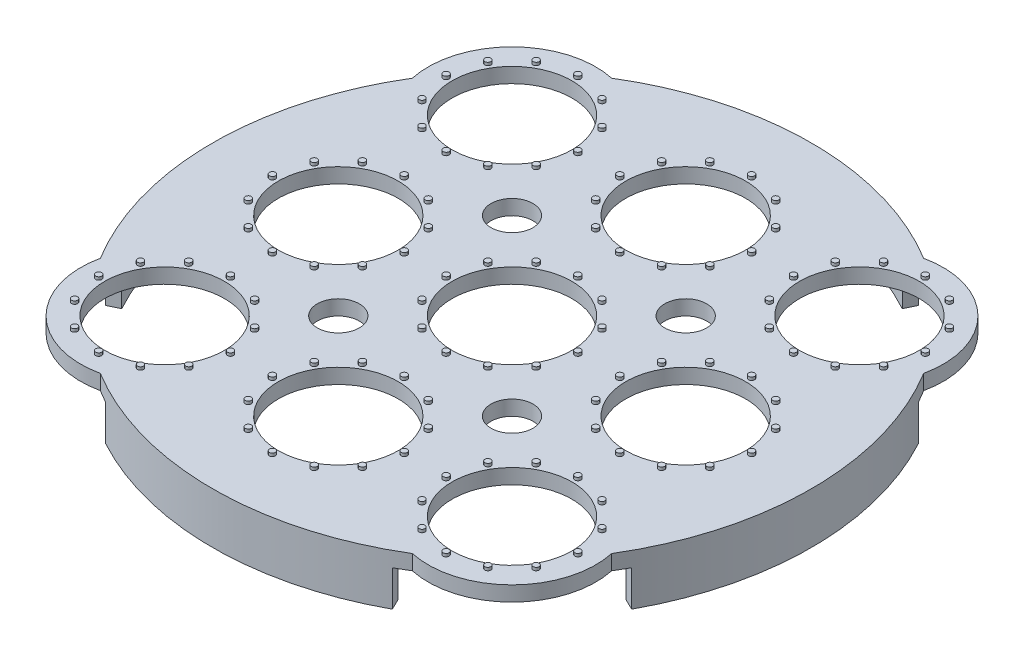
from build123d import *

# Parameters (mm, degrees)
BOSS_EXTRUDE1_DEPTH        = 2.5
SKETCH2_R                  = 10
CUT_EXTRUDE1_DEPTH         = 71.75485849
LPATTERN1_COUNT            = 3
LPATTERN1_PITCH            = 29
LPATTERN1_COUNT_DIR2       = 3
LPATTERN1_PITCH_DIR2       = 29
SKETCH4_R                  = 0.5
BOSS_EXTRUDE2_DEPTH        = 0.5
CIRPATTERN1_COUNT          = 12
LPATTERN2_COUNT            = 3
LPATTERN2_PITCH            = 29
LPATTERN2_COUNT_DIR2       = 3
LPATTERN2_PITCH_DIR2       = 29
LPATTERN2_COPY_1_SKETCH_R  = 0.5
LPATTERN2_COPY_1_DEPTH     = 0.5
LPATTERN2_COPY_2_SKETCH_R  = 0.5
LPATTERN2_COPY_2_DEPTH     = 0.5
LPATTERN2_COPY_3_SKETCH_R  = 0.5
LPATTERN2_COPY_3_DEPTH     = 0.5
LPATTERN2_COPY_4_SKETCH_R  = 0.5
LPATTERN2_COPY_4_DEPTH     = 0.5
LPATTERN2_COPY_5_SKETCH_R  = 0.5
LPATTERN2_COPY_5_DEPTH     = 0.5
LPATTERN2_COPY_6_SKETCH_R  = 0.5
LPATTERN2_COPY_6_DEPTH     = 0.5
LPATTERN2_COPY_7_SKETCH_R  = 0.5
LPATTERN2_COPY_7_DEPTH     = 0.5
LPATTERN2_COPY_8_SKETCH_R  = 0.5
LPATTERN2_COPY_8_DEPTH     = 0.5
LPATTERN2_COPY_9_SKETCH_R  = 0.5
LPATTERN2_COPY_9_DEPTH     = 0.5
LPATTERN2_COPY_10_SKETCH_R = 0.5
LPATTERN2_COPY_10_DEPTH    = 0.5
LPATTERN2_COPY_11_SKETCH_R = 0.5
LPATTERN2_COPY_11_DEPTH    = 0.5
LPATTERN2_COPY_12_SKETCH_R = 0.5
LPATTERN2_COPY_12_DEPTH    = 0.5
LPATTERN2_COPY_13_SKETCH_R = 0.5
LPATTERN2_COPY_13_DEPTH    = 0.5
LPATTERN2_COPY_14_SKETCH_R = 0.5
LPATTERN2_COPY_14_DEPTH    = 0.5
LPATTERN2_COPY_15_SKETCH_R = 0.5
LPATTERN2_COPY_15_DEPTH    = 0.5
LPATTERN2_COPY_16_SKETCH_R = 0.5
LPATTERN2_COPY_16_DEPTH    = 0.5
LPATTERN2_COPY_17_SKETCH_R = 0.5
LPATTERN2_COPY_17_DEPTH    = 0.5
LPATTERN2_COPY_18_SKETCH_R = 0.5
LPATTERN2_COPY_18_DEPTH    = 0.5
LPATTERN2_COPY_19_SKETCH_R = 0.5
LPATTERN2_COPY_19_DEPTH    = 0.5
LPATTERN2_COPY_20_SKETCH_R = 0.5
LPATTERN2_COPY_20_DEPTH    = 0.5
LPATTERN2_COPY_21_SKETCH_R = 0.5
LPATTERN2_COPY_21_DEPTH    = 0.5
LPATTERN2_COPY_22_SKETCH_R = 0.5
LPATTERN2_COPY_22_DEPTH    = 0.5
LPATTERN2_COPY_23_SKETCH_R = 0.5
LPATTERN2_COPY_23_DEPTH    = 0.5
LPATTERN2_COPY_24_SKETCH_R = 0.5
LPATTERN2_COPY_24_DEPTH    = 0.5
LPATTERN2_COPY_25_SKETCH_R = 0.5
LPATTERN2_COPY_25_DEPTH    = 0.5
LPATTERN2_COPY_26_SKETCH_R = 0.5
LPATTERN2_COPY_26_DEPTH    = 0.5
LPATTERN2_COPY_27_SKETCH_R = 0.5
LPATTERN2_COPY_27_DEPTH    = 0.5
LPATTERN2_COPY_28_SKETCH_R = 0.5
LPATTERN2_COPY_28_DEPTH    = 0.5
LPATTERN2_COPY_29_SKETCH_R = 0.5
LPATTERN2_COPY_29_DEPTH    = 0.5
LPATTERN2_COPY_30_SKETCH_R = 0.5
LPATTERN2_COPY_30_DEPTH    = 0.5
LPATTERN2_COPY_31_SKETCH_R = 0.5
LPATTERN2_COPY_31_DEPTH    = 0.5
LPATTERN2_COPY_32_SKETCH_R = 0.5
LPATTERN2_COPY_32_DEPTH    = 0.5
LPATTERN2_COPY_33_SKETCH_R = 0.5
LPATTERN2_COPY_33_DEPTH    = 0.5
LPATTERN2_COPY_34_SKETCH_R = 0.5
LPATTERN2_COPY_34_DEPTH    = 0.5
LPATTERN2_COPY_35_SKETCH_R = 0.5
LPATTERN2_COPY_35_DEPTH    = 0.5
LPATTERN2_COPY_36_SKETCH_R = 0.5
LPATTERN2_COPY_36_DEPTH    = 0.5
LPATTERN2_COPY_37_SKETCH_R = 0.5
LPATTERN2_COPY_37_DEPTH    = 0.5
LPATTERN2_COPY_38_SKETCH_R = 0.5
LPATTERN2_COPY_38_DEPTH    = 0.5
LPATTERN2_COPY_39_SKETCH_R = 0.5
LPATTERN2_COPY_39_DEPTH    = 0.5
LPATTERN2_COPY_40_SKETCH_R = 0.5
LPATTERN2_COPY_40_DEPTH    = 0.5
LPATTERN2_COPY_41_SKETCH_R = 0.5
LPATTERN2_COPY_41_DEPTH    = 0.5
LPATTERN2_COPY_42_SKETCH_R = 0.5
LPATTERN2_COPY_42_DEPTH    = 0.5
LPATTERN2_COPY_43_SKETCH_R = 0.5
LPATTERN2_COPY_43_DEPTH    = 0.5
LPATTERN2_COPY_44_SKETCH_R = 0.5
LPATTERN2_COPY_44_DEPTH    = 0.5
LPATTERN2_COPY_45_SKETCH_R = 0.5
LPATTERN2_COPY_45_DEPTH    = 0.5
LPATTERN2_COPY_46_SKETCH_R = 0.5
LPATTERN2_COPY_46_DEPTH    = 0.5
LPATTERN2_COPY_47_SKETCH_R = 0.5
LPATTERN2_COPY_47_DEPTH    = 0.5
LPATTERN2_COPY_48_SKETCH_R = 0.5
LPATTERN2_COPY_48_DEPTH    = 0.5
LPATTERN2_COPY_49_SKETCH_R = 0.5
LPATTERN2_COPY_49_DEPTH    = 0.5
LPATTERN2_COPY_50_SKETCH_R = 0.5
LPATTERN2_COPY_50_DEPTH    = 0.5
LPATTERN2_COPY_51_SKETCH_R = 0.5
LPATTERN2_COPY_51_DEPTH    = 0.5
LPATTERN2_COPY_52_SKETCH_R = 0.5
LPATTERN2_COPY_52_DEPTH    = 0.5
LPATTERN2_COPY_53_SKETCH_R = 0.5
LPATTERN2_COPY_53_DEPTH    = 0.5
LPATTERN2_COPY_54_SKETCH_R = 0.5
LPATTERN2_COPY_54_DEPTH    = 0.5
LPATTERN2_COPY_55_SKETCH_R = 0.5
LPATTERN2_COPY_55_DEPTH    = 0.5
LPATTERN2_COPY_56_SKETCH_R = 0.5
LPATTERN2_COPY_56_DEPTH    = 0.5
LPATTERN2_COPY_57_SKETCH_R = 0.5
LPATTERN2_COPY_57_DEPTH    = 0.5
LPATTERN2_COPY_58_SKETCH_R = 0.5
LPATTERN2_COPY_58_DEPTH    = 0.5
LPATTERN2_COPY_59_SKETCH_R = 0.5
LPATTERN2_COPY_59_DEPTH    = 0.5
LPATTERN2_COPY_60_SKETCH_R = 0.5
LPATTERN2_COPY_60_DEPTH    = 0.5
LPATTERN2_COPY_61_SKETCH_R = 0.5
LPATTERN2_COPY_61_DEPTH    = 0.5
LPATTERN2_COPY_62_SKETCH_R = 0.5
LPATTERN2_COPY_62_DEPTH    = 0.5
LPATTERN2_COPY_63_SKETCH_R = 0.5
LPATTERN2_COPY_63_DEPTH    = 0.5
LPATTERN2_COPY_64_SKETCH_R = 0.5
LPATTERN2_COPY_64_DEPTH    = 0.5
LPATTERN2_COPY_65_SKETCH_R = 0.5
LPATTERN2_COPY_65_DEPTH    = 0.5
LPATTERN2_COPY_66_SKETCH_R = 0.5
LPATTERN2_COPY_66_DEPTH    = 0.5
LPATTERN2_COPY_67_SKETCH_R = 0.5
LPATTERN2_COPY_67_DEPTH    = 0.5
LPATTERN2_COPY_68_SKETCH_R = 0.5
LPATTERN2_COPY_68_DEPTH    = 0.5
LPATTERN2_COPY_69_SKETCH_R = 0.5
LPATTERN2_COPY_69_DEPTH    = 0.5
LPATTERN2_COPY_70_SKETCH_R = 0.5
LPATTERN2_COPY_70_DEPTH    = 0.5
LPATTERN2_COPY_71_SKETCH_R = 0.5
LPATTERN2_COPY_71_DEPTH    = 0.5
LPATTERN2_COPY_72_SKETCH_R = 0.5
LPATTERN2_COPY_72_DEPTH    = 0.5
LPATTERN2_COPY_73_SKETCH_R = 0.5
LPATTERN2_COPY_73_DEPTH    = 0.5
LPATTERN2_COPY_74_SKETCH_R = 0.5
LPATTERN2_COPY_74_DEPTH    = 0.5
LPATTERN2_COPY_75_SKETCH_R = 0.5
LPATTERN2_COPY_75_DEPTH    = 0.5
LPATTERN2_COPY_76_SKETCH_R = 0.5
LPATTERN2_COPY_76_DEPTH    = 0.5
LPATTERN2_COPY_77_SKETCH_R = 0.5
LPATTERN2_COPY_77_DEPTH    = 0.5
LPATTERN2_COPY_78_SKETCH_R = 0.5
LPATTERN2_COPY_78_DEPTH    = 0.5
LPATTERN2_COPY_79_SKETCH_R = 0.5
LPATTERN2_COPY_79_DEPTH    = 0.5
LPATTERN2_COPY_80_SKETCH_R = 0.5
LPATTERN2_COPY_80_DEPTH    = 0.5
LPATTERN2_COPY_81_SKETCH_R = 0.5
LPATTERN2_COPY_81_DEPTH    = 0.5
LPATTERN2_COPY_82_SKETCH_R = 0.5
LPATTERN2_COPY_82_DEPTH    = 0.5
LPATTERN2_COPY_83_SKETCH_R = 0.5
LPATTERN2_COPY_83_DEPTH    = 0.5
LPATTERN2_COPY_84_SKETCH_R = 0.5
LPATTERN2_COPY_84_DEPTH    = 0.5
LPATTERN2_COPY_85_SKETCH_R = 0.5
LPATTERN2_COPY_85_DEPTH    = 0.5
LPATTERN2_COPY_86_SKETCH_R = 0.5
LPATTERN2_COPY_86_DEPTH    = 0.5
LPATTERN2_COPY_87_SKETCH_R = 0.5
LPATTERN2_COPY_87_DEPTH    = 0.5
LPATTERN2_COPY_88_SKETCH_R = 0.5
LPATTERN2_COPY_88_DEPTH    = 0.5
SKETCH5_R                  = 3.5
CUT_EXTRUDE2_DEPTH         = 71.75485849
MIRROR2_COPY_1_SKETCH_R    = 3.5
MIRROR2_COPY_1_DEPTH       = 71.75485849
BOSS_EXTRUDE3_START        = 6
BOSS_EXTRUDE3_DEPTH        = 6
CIRPATTERN2_COUNT          = 4


with BuildPart() as part:
    # Sketch1 → Boss-Extrude1 (new body)
    with BuildSketch(Plane(origin=(0, 0, 0), x_dir=(1, 0, 0), z_dir=(0, 1, 0))):
        with BuildLine():
            ThreePointArc((26.040517643, 42.683620288), (0, 50), (-26.040517643, 42.683620288))
            ThreePointArc((-26.040517643, 42.683620288), (-38.899494937, 38.899494937), (-42.683620288, 26.040517643))
            ThreePointArc((-42.683620288, 26.040517643), (-50, 0), (-42.683620288, -26.040517643))
            ThreePointArc((-42.683620288, -26.040517643), (-38.899494937, -38.899494937), (-26.040517643, -42.683620288))
            ThreePointArc((-26.040517643, -42.683620288), (0, -50), (26.040517643, -42.683620288))
            ThreePointArc((26.040517643, -42.683620288), (38.899494937, -38.899494937), (42.683620288, -26.040517643))
            ThreePointArc((42.683620288, -26.040517643), (50, 0), (42.683620288, 26.040517643))
            ThreePointArc((42.683620288, 26.040517643), (38.899494937, 38.899494937), (26.040517643, 42.683620288))
        make_face()
    extrude(amount=BOSS_EXTRUDE1_DEPTH)

    # Sketch2 → Cut-Extrude1 (cut, through all)
    with BuildSketch(Plane(origin=(0, 2.5, 0), x_dir=(1, 0, 0), z_dir=(0, 1, 0))):
        with Locations((-29, -29)):
            Circle(SKETCH2_R)
    cut_extrude1 = extrude(amount=-CUT_EXTRUDE1_DEPTH, mode=Mode.SUBTRACT)

    # LPattern1: Cut-Extrude1 3 × 3
    with Locations(*[(i * LPATTERN1_PITCH, 0, -j * LPATTERN1_PITCH_DIR2) for i in range(LPATTERN1_COUNT) for j in range(LPATTERN1_COUNT_DIR2) if (i, j) != (0, 0)]):
        add(cut_extrude1, mode=Mode.SUBTRACT)

    # Sketch4 → Boss-Extrude2 (add)
    with BuildSketch(Plane(origin=(0, 2.5, 0), x_dir=(1, 0, 0), z_dir=(0, 1, 0))):
        with Locations((-29, -18)):
            Circle(SKETCH4_R)
    boss_extrude2 = extrude(amount=BOSS_EXTRUDE2_DEPTH)

    # CirPattern1: Boss-Extrude2 ×12 about axis
    cirpattern1_axis = Axis((-29, 0, 29), (0, 1, 0))
    for i in range(1, CIRPATTERN1_COUNT):
        add(boss_extrude2.rotate(cirpattern1_axis, i * 360 / CIRPATTERN1_COUNT))

    # LPattern2: Boss-Extrude2 3 × 3
    with Locations(*[(j * LPATTERN2_PITCH_DIR2, 0, -i * LPATTERN2_PITCH) for i in range(LPATTERN2_COUNT) for j in range(LPATTERN2_COUNT_DIR2) if (i, j) != (0, 0)]):
        add(boss_extrude2)

    # LPattern2 copy 1 sketch → LPattern2 copy 1 (add)
    with BuildSketch(Plane(origin=(10.61473671, 2.5, -10.61473671), x_dir=(0.8660254037844387, 0, -0.49999999999999994), z_dir=(0, 1, 0))):
        with Locations((-29, -18)):
            Circle(LPATTERN2_COPY_1_SKETCH_R)
    extrude(amount=LPATTERN2_COPY_1_DEPTH)

    # LPattern2 copy 2 sketch → LPattern2 copy 2 (add)
    with BuildSketch(Plane(origin=(39.61473671, 2.5, -10.61473671), x_dir=(0.8660254037844387, 0, -0.49999999999999994), z_dir=(0, 1, 0))):
        with Locations((-29, -18)):
            Circle(LPATTERN2_COPY_2_SKETCH_R)
    extrude(amount=LPATTERN2_COPY_2_DEPTH)

    # LPattern2 copy 3 sketch → LPattern2 copy 3 (add)
    with BuildSketch(Plane(origin=(-18.38526329, 2.5, -39.61473671), x_dir=(0.8660254037844387, 0, -0.49999999999999994), z_dir=(0, 1, 0))):
        with Locations((-29, -18)):
            Circle(LPATTERN2_COPY_3_SKETCH_R)
    extrude(amount=LPATTERN2_COPY_3_DEPTH)

    # LPattern2 copy 4 sketch → LPattern2 copy 4 (add)
    with BuildSketch(Plane(origin=(10.61473671, 2.5, -39.61473671), x_dir=(0.8660254037844387, 0, -0.49999999999999994), z_dir=(0, 1, 0))):
        with Locations((-29, -18)):
            Circle(LPATTERN2_COPY_4_SKETCH_R)
    extrude(amount=LPATTERN2_COPY_4_DEPTH)

    # LPattern2 copy 5 sketch → LPattern2 copy 5 (add)
    with BuildSketch(Plane(origin=(39.61473671, 2.5, -39.61473671), x_dir=(0.8660254037844387, 0, -0.49999999999999994), z_dir=(0, 1, 0))):
        with Locations((-29, -18)):
            Circle(LPATTERN2_COPY_5_SKETCH_R)
    extrude(amount=LPATTERN2_COPY_5_DEPTH)

    # LPattern2 copy 6 sketch → LPattern2 copy 6 (add)
    with BuildSketch(Plane(origin=(-18.38526329, 2.5, -68.61473671), x_dir=(0.8660254037844387, 0, -0.49999999999999994), z_dir=(0, 1, 0))):
        with Locations((-29, -18)):
            Circle(LPATTERN2_COPY_6_SKETCH_R)
    extrude(amount=LPATTERN2_COPY_6_DEPTH)

    # LPattern2 copy 7 sketch → LPattern2 copy 7 (add)
    with BuildSketch(Plane(origin=(10.61473671, 2.5, -68.61473671), x_dir=(0.8660254037844387, 0, -0.49999999999999994), z_dir=(0, 1, 0))):
        with Locations((-29, -18)):
            Circle(LPATTERN2_COPY_7_SKETCH_R)
    extrude(amount=LPATTERN2_COPY_7_DEPTH)

    # LPattern2 copy 8 sketch → LPattern2 copy 8 (add)
    with BuildSketch(Plane(origin=(39.61473671, 2.5, -68.61473671), x_dir=(0.8660254037844387, 0, -0.49999999999999994), z_dir=(0, 1, 0))):
        with Locations((-29, -18)):
            Circle(LPATTERN2_COPY_8_SKETCH_R)
    extrude(amount=LPATTERN2_COPY_8_DEPTH)

    # LPattern2 copy 9 sketch → LPattern2 copy 9 (add)
    with BuildSketch(Plane(origin=(-10.61473671, 2.5, -10.61473671), x_dir=(0.5000000000000001, 0, -0.8660254037844386), z_dir=(0, 1, 0))):
        with Locations((-29, -18)):
            Circle(LPATTERN2_COPY_9_SKETCH_R)
    extrude(amount=LPATTERN2_COPY_9_DEPTH)

    # LPattern2 copy 10 sketch → LPattern2 copy 10 (add)
    with BuildSketch(Plane(origin=(18.38526329, 2.5, -10.61473671), x_dir=(0.5000000000000001, 0, -0.8660254037844386), z_dir=(0, 1, 0))):
        with Locations((-29, -18)):
            Circle(LPATTERN2_COPY_10_SKETCH_R)
    extrude(amount=LPATTERN2_COPY_10_DEPTH)

    # LPattern2 copy 11 sketch → LPattern2 copy 11 (add)
    with BuildSketch(Plane(origin=(-39.61473671, 2.5, -39.61473671), x_dir=(0.5000000000000001, 0, -0.8660254037844386), z_dir=(0, 1, 0))):
        with Locations((-29, -18)):
            Circle(LPATTERN2_COPY_11_SKETCH_R)
    extrude(amount=LPATTERN2_COPY_11_DEPTH)

    # LPattern2 copy 12 sketch → LPattern2 copy 12 (add)
    with BuildSketch(Plane(origin=(-10.61473671, 2.5, -39.61473671), x_dir=(0.5000000000000001, 0, -0.8660254037844386), z_dir=(0, 1, 0))):
        with Locations((-29, -18)):
            Circle(LPATTERN2_COPY_12_SKETCH_R)
    extrude(amount=LPATTERN2_COPY_12_DEPTH)

    # LPattern2 copy 13 sketch → LPattern2 copy 13 (add)
    with BuildSketch(Plane(origin=(18.38526329, 2.5, -39.61473671), x_dir=(0.5000000000000001, 0, -0.8660254037844386), z_dir=(0, 1, 0))):
        with Locations((-29, -18)):
            Circle(LPATTERN2_COPY_13_SKETCH_R)
    extrude(amount=LPATTERN2_COPY_13_DEPTH)

    # LPattern2 copy 14 sketch → LPattern2 copy 14 (add)
    with BuildSketch(Plane(origin=(-39.61473671, 2.5, -68.61473671), x_dir=(0.5000000000000001, 0, -0.8660254037844386), z_dir=(0, 1, 0))):
        with Locations((-29, -18)):
            Circle(LPATTERN2_COPY_14_SKETCH_R)
    extrude(amount=LPATTERN2_COPY_14_DEPTH)

    # LPattern2 copy 15 sketch → LPattern2 copy 15 (add)
    with BuildSketch(Plane(origin=(-10.61473671, 2.5, -68.61473671), x_dir=(0.5000000000000001, 0, -0.8660254037844386), z_dir=(0, 1, 0))):
        with Locations((-29, -18)):
            Circle(LPATTERN2_COPY_15_SKETCH_R)
    extrude(amount=LPATTERN2_COPY_15_DEPTH)

    # LPattern2 copy 16 sketch → LPattern2 copy 16 (add)
    with BuildSketch(Plane(origin=(18.38526329, 2.5, -68.61473671), x_dir=(0.5000000000000001, 0, -0.8660254037844386), z_dir=(0, 1, 0))):
        with Locations((-29, -18)):
            Circle(LPATTERN2_COPY_16_SKETCH_R)
    extrude(amount=LPATTERN2_COPY_16_DEPTH)

    # LPattern2 copy 17 sketch → LPattern2 copy 17 (add)
    with BuildSketch(Plane(origin=(-29, 2.5, 0), x_dir=(0, 0, -1), z_dir=(0, 1, 0))):
        with Locations((-29, -18)):
            Circle(LPATTERN2_COPY_17_SKETCH_R)
    extrude(amount=LPATTERN2_COPY_17_DEPTH)

    # LPattern2 copy 18 sketch → LPattern2 copy 18 (add)
    with BuildSketch(Plane(origin=(0, 2.5, 0), x_dir=(0, 0, -1), z_dir=(0, 1, 0))):
        with Locations((-29, -18)):
            Circle(LPATTERN2_COPY_18_SKETCH_R)
    extrude(amount=LPATTERN2_COPY_18_DEPTH)

    # LPattern2 copy 19 sketch → LPattern2 copy 19 (add)
    with BuildSketch(Plane(origin=(-58, 2.5, -29), x_dir=(0, 0, -1), z_dir=(0, 1, 0))):
        with Locations((-29, -18)):
            Circle(LPATTERN2_COPY_19_SKETCH_R)
    extrude(amount=LPATTERN2_COPY_19_DEPTH)

    # LPattern2 copy 20 sketch → LPattern2 copy 20 (add)
    with BuildSketch(Plane(origin=(-29, 2.5, -29), x_dir=(0, 0, -1), z_dir=(0, 1, 0))):
        with Locations((-29, -18)):
            Circle(LPATTERN2_COPY_20_SKETCH_R)
    extrude(amount=LPATTERN2_COPY_20_DEPTH)

    # LPattern2 copy 21 sketch → LPattern2 copy 21 (add)
    with BuildSketch(Plane(origin=(0, 2.5, -29), x_dir=(0, 0, -1), z_dir=(0, 1, 0))):
        with Locations((-29, -18)):
            Circle(LPATTERN2_COPY_21_SKETCH_R)
    extrude(amount=LPATTERN2_COPY_21_DEPTH)

    # LPattern2 copy 22 sketch → LPattern2 copy 22 (add)
    with BuildSketch(Plane(origin=(-58, 2.5, -58), x_dir=(0, 0, -1), z_dir=(0, 1, 0))):
        with Locations((-29, -18)):
            Circle(LPATTERN2_COPY_22_SKETCH_R)
    extrude(amount=LPATTERN2_COPY_22_DEPTH)

    # LPattern2 copy 23 sketch → LPattern2 copy 23 (add)
    with BuildSketch(Plane(origin=(-29, 2.5, -58), x_dir=(0, 0, -1), z_dir=(0, 1, 0))):
        with Locations((-29, -18)):
            Circle(LPATTERN2_COPY_23_SKETCH_R)
    extrude(amount=LPATTERN2_COPY_23_DEPTH)

    # LPattern2 copy 24 sketch → LPattern2 copy 24 (add)
    with BuildSketch(Plane(origin=(0, 2.5, -58), x_dir=(0, 0, -1), z_dir=(0, 1, 0))):
        with Locations((-29, -18)):
            Circle(LPATTERN2_COPY_24_SKETCH_R)
    extrude(amount=LPATTERN2_COPY_24_DEPTH)

    # LPattern2 copy 25 sketch → LPattern2 copy 25 (add)
    with BuildSketch(Plane(origin=(-39.61473671, 2.5, 18.38526329), x_dir=(-0.4999999999999998, 0, -0.8660254037844387), z_dir=(0, 1, 0))):
        with Locations((-29, -18)):
            Circle(LPATTERN2_COPY_25_SKETCH_R)
    extrude(amount=LPATTERN2_COPY_25_DEPTH)

    # LPattern2 copy 26 sketch → LPattern2 copy 26 (add)
    with BuildSketch(Plane(origin=(-10.61473671, 2.5, 18.38526329), x_dir=(-0.4999999999999998, 0, -0.8660254037844387), z_dir=(0, 1, 0))):
        with Locations((-29, -18)):
            Circle(LPATTERN2_COPY_26_SKETCH_R)
    extrude(amount=LPATTERN2_COPY_26_DEPTH)

    # LPattern2 copy 27 sketch → LPattern2 copy 27 (add)
    with BuildSketch(Plane(origin=(-68.61473671, 2.5, -10.61473671), x_dir=(-0.4999999999999998, 0, -0.8660254037844387), z_dir=(0, 1, 0))):
        with Locations((-29, -18)):
            Circle(LPATTERN2_COPY_27_SKETCH_R)
    extrude(amount=LPATTERN2_COPY_27_DEPTH)

    # LPattern2 copy 28 sketch → LPattern2 copy 28 (add)
    with BuildSketch(Plane(origin=(-39.61473671, 2.5, -10.61473671), x_dir=(-0.4999999999999998, 0, -0.8660254037844387), z_dir=(0, 1, 0))):
        with Locations((-29, -18)):
            Circle(LPATTERN2_COPY_28_SKETCH_R)
    extrude(amount=LPATTERN2_COPY_28_DEPTH)

    # LPattern2 copy 29 sketch → LPattern2 copy 29 (add)
    with BuildSketch(Plane(origin=(-10.61473671, 2.5, -10.61473671), x_dir=(-0.4999999999999998, 0, -0.8660254037844387), z_dir=(0, 1, 0))):
        with Locations((-29, -18)):
            Circle(LPATTERN2_COPY_29_SKETCH_R)
    extrude(amount=LPATTERN2_COPY_29_DEPTH)

    # LPattern2 copy 30 sketch → LPattern2 copy 30 (add)
    with BuildSketch(Plane(origin=(-68.61473671, 2.5, -39.61473671), x_dir=(-0.4999999999999998, 0, -0.8660254037844387), z_dir=(0, 1, 0))):
        with Locations((-29, -18)):
            Circle(LPATTERN2_COPY_30_SKETCH_R)
    extrude(amount=LPATTERN2_COPY_30_DEPTH)

    # LPattern2 copy 31 sketch → LPattern2 copy 31 (add)
    with BuildSketch(Plane(origin=(-39.61473671, 2.5, -39.61473671), x_dir=(-0.4999999999999998, 0, -0.8660254037844387), z_dir=(0, 1, 0))):
        with Locations((-29, -18)):
            Circle(LPATTERN2_COPY_31_SKETCH_R)
    extrude(amount=LPATTERN2_COPY_31_DEPTH)

    # LPattern2 copy 32 sketch → LPattern2 copy 32 (add)
    with BuildSketch(Plane(origin=(-10.61473671, 2.5, -39.61473671), x_dir=(-0.4999999999999998, 0, -0.8660254037844387), z_dir=(0, 1, 0))):
        with Locations((-29, -18)):
            Circle(LPATTERN2_COPY_32_SKETCH_R)
    extrude(amount=LPATTERN2_COPY_32_DEPTH)

    # LPattern2 copy 33 sketch → LPattern2 copy 33 (add)
    with BuildSketch(Plane(origin=(-39.61473671, 2.5, 39.61473671), x_dir=(-0.8660254037844387, 0, -0.49999999999999994), z_dir=(0, 1, 0))):
        with Locations((-29, -18)):
            Circle(LPATTERN2_COPY_33_SKETCH_R)
    extrude(amount=LPATTERN2_COPY_33_DEPTH)

    # LPattern2 copy 34 sketch → LPattern2 copy 34 (add)
    with BuildSketch(Plane(origin=(-10.61473671, 2.5, 39.61473671), x_dir=(-0.8660254037844387, 0, -0.49999999999999994), z_dir=(0, 1, 0))):
        with Locations((-29, -18)):
            Circle(LPATTERN2_COPY_34_SKETCH_R)
    extrude(amount=LPATTERN2_COPY_34_DEPTH)

    # LPattern2 copy 35 sketch → LPattern2 copy 35 (add)
    with BuildSketch(Plane(origin=(-68.61473671, 2.5, 10.61473671), x_dir=(-0.8660254037844387, 0, -0.49999999999999994), z_dir=(0, 1, 0))):
        with Locations((-29, -18)):
            Circle(LPATTERN2_COPY_35_SKETCH_R)
    extrude(amount=LPATTERN2_COPY_35_DEPTH)

    # LPattern2 copy 36 sketch → LPattern2 copy 36 (add)
    with BuildSketch(Plane(origin=(-39.61473671, 2.5, 10.61473671), x_dir=(-0.8660254037844387, 0, -0.49999999999999994), z_dir=(0, 1, 0))):
        with Locations((-29, -18)):
            Circle(LPATTERN2_COPY_36_SKETCH_R)
    extrude(amount=LPATTERN2_COPY_36_DEPTH)

    # LPattern2 copy 37 sketch → LPattern2 copy 37 (add)
    with BuildSketch(Plane(origin=(-10.61473671, 2.5, 10.61473671), x_dir=(-0.8660254037844387, 0, -0.49999999999999994), z_dir=(0, 1, 0))):
        with Locations((-29, -18)):
            Circle(LPATTERN2_COPY_37_SKETCH_R)
    extrude(amount=LPATTERN2_COPY_37_DEPTH)

    # LPattern2 copy 38 sketch → LPattern2 copy 38 (add)
    with BuildSketch(Plane(origin=(-68.61473671, 2.5, -18.38526329), x_dir=(-0.8660254037844387, 0, -0.49999999999999994), z_dir=(0, 1, 0))):
        with Locations((-29, -18)):
            Circle(LPATTERN2_COPY_38_SKETCH_R)
    extrude(amount=LPATTERN2_COPY_38_DEPTH)

    # LPattern2 copy 39 sketch → LPattern2 copy 39 (add)
    with BuildSketch(Plane(origin=(-39.61473671, 2.5, -18.38526329), x_dir=(-0.8660254037844387, 0, -0.49999999999999994), z_dir=(0, 1, 0))):
        with Locations((-29, -18)):
            Circle(LPATTERN2_COPY_39_SKETCH_R)
    extrude(amount=LPATTERN2_COPY_39_DEPTH)

    # LPattern2 copy 40 sketch → LPattern2 copy 40 (add)
    with BuildSketch(Plane(origin=(-10.61473671, 2.5, -18.38526329), x_dir=(-0.8660254037844387, 0, -0.49999999999999994), z_dir=(0, 1, 0))):
        with Locations((-29, -18)):
            Circle(LPATTERN2_COPY_40_SKETCH_R)
    extrude(amount=LPATTERN2_COPY_40_DEPTH)

    # LPattern2 copy 41 sketch → LPattern2 copy 41 (add)
    with BuildSketch(Plane(origin=(-29, 2.5, 58), x_dir=(-1, 0, 0), z_dir=(0, 1, 0))):
        with Locations((-29, -18)):
            Circle(LPATTERN2_COPY_41_SKETCH_R)
    extrude(amount=LPATTERN2_COPY_41_DEPTH)

    # LPattern2 copy 42 sketch → LPattern2 copy 42 (add)
    with BuildSketch(Plane(origin=(0, 2.5, 58), x_dir=(-1, 0, 0), z_dir=(0, 1, 0))):
        with Locations((-29, -18)):
            Circle(LPATTERN2_COPY_42_SKETCH_R)
    extrude(amount=LPATTERN2_COPY_42_DEPTH)

    # LPattern2 copy 43 sketch → LPattern2 copy 43 (add)
    with BuildSketch(Plane(origin=(-58, 2.5, 29), x_dir=(-1, 0, 0), z_dir=(0, 1, 0))):
        with Locations((-29, -18)):
            Circle(LPATTERN2_COPY_43_SKETCH_R)
    extrude(amount=LPATTERN2_COPY_43_DEPTH)

    # LPattern2 copy 44 sketch → LPattern2 copy 44 (add)
    with BuildSketch(Plane(origin=(-29, 2.5, 29), x_dir=(-1, 0, 0), z_dir=(0, 1, 0))):
        with Locations((-29, -18)):
            Circle(LPATTERN2_COPY_44_SKETCH_R)
    extrude(amount=LPATTERN2_COPY_44_DEPTH)

    # LPattern2 copy 45 sketch → LPattern2 copy 45 (add)
    with BuildSketch(Plane(origin=(0, 2.5, 29), x_dir=(-1, 0, 0), z_dir=(0, 1, 0))):
        with Locations((-29, -18)):
            Circle(LPATTERN2_COPY_45_SKETCH_R)
    extrude(amount=LPATTERN2_COPY_45_DEPTH)

    # LPattern2 copy 46 sketch → LPattern2 copy 46 (add)
    with BuildSketch(Plane(origin=(-58, 2.5, 0), x_dir=(-1, 0, 0), z_dir=(0, 1, 0))):
        with Locations((-29, -18)):
            Circle(LPATTERN2_COPY_46_SKETCH_R)
    extrude(amount=LPATTERN2_COPY_46_DEPTH)

    # LPattern2 copy 47 sketch → LPattern2 copy 47 (add)
    with BuildSketch(Plane(origin=(-29, 2.5, 0), x_dir=(-1, 0, 0), z_dir=(0, 1, 0))):
        with Locations((-29, -18)):
            Circle(LPATTERN2_COPY_47_SKETCH_R)
    extrude(amount=LPATTERN2_COPY_47_DEPTH)

    # LPattern2 copy 48 sketch → LPattern2 copy 48 (add)
    with BuildSketch(Plane(origin=(0, 2.5, 0), x_dir=(-1, 0, 0), z_dir=(0, 1, 0))):
        with Locations((-29, -18)):
            Circle(LPATTERN2_COPY_48_SKETCH_R)
    extrude(amount=LPATTERN2_COPY_48_DEPTH)

    # LPattern2 copy 49 sketch → LPattern2 copy 49 (add)
    with BuildSketch(Plane(origin=(-10.61473671, 2.5, 68.61473671), x_dir=(-0.8660254037844386, 0, 0.5000000000000001), z_dir=(0, 1, 0))):
        with Locations((-29, -18)):
            Circle(LPATTERN2_COPY_49_SKETCH_R)
    extrude(amount=LPATTERN2_COPY_49_DEPTH)

    # LPattern2 copy 50 sketch → LPattern2 copy 50 (add)
    with BuildSketch(Plane(origin=(18.38526329, 2.5, 68.61473671), x_dir=(-0.8660254037844386, 0, 0.5000000000000001), z_dir=(0, 1, 0))):
        with Locations((-29, -18)):
            Circle(LPATTERN2_COPY_50_SKETCH_R)
    extrude(amount=LPATTERN2_COPY_50_DEPTH)

    # LPattern2 copy 51 sketch → LPattern2 copy 51 (add)
    with BuildSketch(Plane(origin=(-39.61473671, 2.5, 39.61473671), x_dir=(-0.8660254037844386, 0, 0.5000000000000001), z_dir=(0, 1, 0))):
        with Locations((-29, -18)):
            Circle(LPATTERN2_COPY_51_SKETCH_R)
    extrude(amount=LPATTERN2_COPY_51_DEPTH)

    # LPattern2 copy 52 sketch → LPattern2 copy 52 (add)
    with BuildSketch(Plane(origin=(-10.61473671, 2.5, 39.61473671), x_dir=(-0.8660254037844386, 0, 0.5000000000000001), z_dir=(0, 1, 0))):
        with Locations((-29, -18)):
            Circle(LPATTERN2_COPY_52_SKETCH_R)
    extrude(amount=LPATTERN2_COPY_52_DEPTH)

    # LPattern2 copy 53 sketch → LPattern2 copy 53 (add)
    with BuildSketch(Plane(origin=(18.38526329, 2.5, 39.61473671), x_dir=(-0.8660254037844386, 0, 0.5000000000000001), z_dir=(0, 1, 0))):
        with Locations((-29, -18)):
            Circle(LPATTERN2_COPY_53_SKETCH_R)
    extrude(amount=LPATTERN2_COPY_53_DEPTH)

    # LPattern2 copy 54 sketch → LPattern2 copy 54 (add)
    with BuildSketch(Plane(origin=(-39.61473671, 2.5, 10.61473671), x_dir=(-0.8660254037844386, 0, 0.5000000000000001), z_dir=(0, 1, 0))):
        with Locations((-29, -18)):
            Circle(LPATTERN2_COPY_54_SKETCH_R)
    extrude(amount=LPATTERN2_COPY_54_DEPTH)

    # LPattern2 copy 55 sketch → LPattern2 copy 55 (add)
    with BuildSketch(Plane(origin=(-10.61473671, 2.5, 10.61473671), x_dir=(-0.8660254037844386, 0, 0.5000000000000001), z_dir=(0, 1, 0))):
        with Locations((-29, -18)):
            Circle(LPATTERN2_COPY_55_SKETCH_R)
    extrude(amount=LPATTERN2_COPY_55_DEPTH)

    # LPattern2 copy 56 sketch → LPattern2 copy 56 (add)
    with BuildSketch(Plane(origin=(18.38526329, 2.5, 10.61473671), x_dir=(-0.8660254037844386, 0, 0.5000000000000001), z_dir=(0, 1, 0))):
        with Locations((-29, -18)):
            Circle(LPATTERN2_COPY_56_SKETCH_R)
    extrude(amount=LPATTERN2_COPY_56_DEPTH)

    # LPattern2 copy 57 sketch → LPattern2 copy 57 (add)
    with BuildSketch(Plane(origin=(10.61473671, 2.5, 68.61473671), x_dir=(-0.5000000000000004, 0, 0.8660254037844384), z_dir=(0, 1, 0))):
        with Locations((-29, -18)):
            Circle(LPATTERN2_COPY_57_SKETCH_R)
    extrude(amount=LPATTERN2_COPY_57_DEPTH)

    # LPattern2 copy 58 sketch → LPattern2 copy 58 (add)
    with BuildSketch(Plane(origin=(39.61473671, 2.5, 68.61473671), x_dir=(-0.5000000000000004, 0, 0.8660254037844384), z_dir=(0, 1, 0))):
        with Locations((-29, -18)):
            Circle(LPATTERN2_COPY_58_SKETCH_R)
    extrude(amount=LPATTERN2_COPY_58_DEPTH)

    # LPattern2 copy 59 sketch → LPattern2 copy 59 (add)
    with BuildSketch(Plane(origin=(-18.38526329, 2.5, 39.61473671), x_dir=(-0.5000000000000004, 0, 0.8660254037844384), z_dir=(0, 1, 0))):
        with Locations((-29, -18)):
            Circle(LPATTERN2_COPY_59_SKETCH_R)
    extrude(amount=LPATTERN2_COPY_59_DEPTH)

    # LPattern2 copy 60 sketch → LPattern2 copy 60 (add)
    with BuildSketch(Plane(origin=(10.61473671, 2.5, 39.61473671), x_dir=(-0.5000000000000004, 0, 0.8660254037844384), z_dir=(0, 1, 0))):
        with Locations((-29, -18)):
            Circle(LPATTERN2_COPY_60_SKETCH_R)
    extrude(amount=LPATTERN2_COPY_60_DEPTH)

    # LPattern2 copy 61 sketch → LPattern2 copy 61 (add)
    with BuildSketch(Plane(origin=(39.61473671, 2.5, 39.61473671), x_dir=(-0.5000000000000004, 0, 0.8660254037844384), z_dir=(0, 1, 0))):
        with Locations((-29, -18)):
            Circle(LPATTERN2_COPY_61_SKETCH_R)
    extrude(amount=LPATTERN2_COPY_61_DEPTH)

    # LPattern2 copy 62 sketch → LPattern2 copy 62 (add)
    with BuildSketch(Plane(origin=(-18.38526329, 2.5, 10.61473671), x_dir=(-0.5000000000000004, 0, 0.8660254037844384), z_dir=(0, 1, 0))):
        with Locations((-29, -18)):
            Circle(LPATTERN2_COPY_62_SKETCH_R)
    extrude(amount=LPATTERN2_COPY_62_DEPTH)

    # LPattern2 copy 63 sketch → LPattern2 copy 63 (add)
    with BuildSketch(Plane(origin=(10.61473671, 2.5, 10.61473671), x_dir=(-0.5000000000000004, 0, 0.8660254037844384), z_dir=(0, 1, 0))):
        with Locations((-29, -18)):
            Circle(LPATTERN2_COPY_63_SKETCH_R)
    extrude(amount=LPATTERN2_COPY_63_DEPTH)

    # LPattern2 copy 64 sketch → LPattern2 copy 64 (add)
    with BuildSketch(Plane(origin=(39.61473671, 2.5, 10.61473671), x_dir=(-0.5000000000000004, 0, 0.8660254037844384), z_dir=(0, 1, 0))):
        with Locations((-29, -18)):
            Circle(LPATTERN2_COPY_64_SKETCH_R)
    extrude(amount=LPATTERN2_COPY_64_DEPTH)

    # LPattern2 copy 65 sketch → LPattern2 copy 65 (add)
    with BuildSketch(Plane(origin=(29, 2.5, 58), x_dir=(0, 0, 1), z_dir=(0, 1, 0))):
        with Locations((-29, -18)):
            Circle(LPATTERN2_COPY_65_SKETCH_R)
    extrude(amount=LPATTERN2_COPY_65_DEPTH)

    # LPattern2 copy 66 sketch → LPattern2 copy 66 (add)
    with BuildSketch(Plane(origin=(58, 2.5, 58), x_dir=(0, 0, 1), z_dir=(0, 1, 0))):
        with Locations((-29, -18)):
            Circle(LPATTERN2_COPY_66_SKETCH_R)
    extrude(amount=LPATTERN2_COPY_66_DEPTH)

    # LPattern2 copy 67 sketch → LPattern2 copy 67 (add)
    with BuildSketch(Plane(origin=(0, 2.5, 29), x_dir=(0, 0, 1), z_dir=(0, 1, 0))):
        with Locations((-29, -18)):
            Circle(LPATTERN2_COPY_67_SKETCH_R)
    extrude(amount=LPATTERN2_COPY_67_DEPTH)

    # LPattern2 copy 68 sketch → LPattern2 copy 68 (add)
    with BuildSketch(Plane(origin=(29, 2.5, 29), x_dir=(0, 0, 1), z_dir=(0, 1, 0))):
        with Locations((-29, -18)):
            Circle(LPATTERN2_COPY_68_SKETCH_R)
    extrude(amount=LPATTERN2_COPY_68_DEPTH)

    # LPattern2 copy 69 sketch → LPattern2 copy 69 (add)
    with BuildSketch(Plane(origin=(58, 2.5, 29), x_dir=(0, 0, 1), z_dir=(0, 1, 0))):
        with Locations((-29, -18)):
            Circle(LPATTERN2_COPY_69_SKETCH_R)
    extrude(amount=LPATTERN2_COPY_69_DEPTH)

    # LPattern2 copy 70 sketch → LPattern2 copy 70 (add)
    with BuildSketch(Plane.ZX.offset(2.5)):
        with Locations((-29, -18)):
            Circle(LPATTERN2_COPY_70_SKETCH_R)
    extrude(amount=LPATTERN2_COPY_70_DEPTH)

    # LPattern2 copy 71 sketch → LPattern2 copy 71 (add)
    with BuildSketch(Plane(origin=(29, 2.5, 0), x_dir=(0, 0, 1), z_dir=(0, 1, 0))):
        with Locations((-29, -18)):
            Circle(LPATTERN2_COPY_71_SKETCH_R)
    extrude(amount=LPATTERN2_COPY_71_DEPTH)

    # LPattern2 copy 72 sketch → LPattern2 copy 72 (add)
    with BuildSketch(Plane(origin=(58, 2.5, 0), x_dir=(0, 0, 1), z_dir=(0, 1, 0))):
        with Locations((-29, -18)):
            Circle(LPATTERN2_COPY_72_SKETCH_R)
    extrude(amount=LPATTERN2_COPY_72_DEPTH)

    # LPattern2 copy 73 sketch → LPattern2 copy 73 (add)
    with BuildSketch(Plane(origin=(39.61473671, 2.5, 39.61473671), x_dir=(0.5000000000000001, 0, 0.8660254037844386), z_dir=(0, 1, 0))):
        with Locations((-29, -18)):
            Circle(LPATTERN2_COPY_73_SKETCH_R)
    extrude(amount=LPATTERN2_COPY_73_DEPTH)

    # LPattern2 copy 74 sketch → LPattern2 copy 74 (add)
    with BuildSketch(Plane(origin=(68.61473671, 2.5, 39.61473671), x_dir=(0.5000000000000001, 0, 0.8660254037844386), z_dir=(0, 1, 0))):
        with Locations((-29, -18)):
            Circle(LPATTERN2_COPY_74_SKETCH_R)
    extrude(amount=LPATTERN2_COPY_74_DEPTH)

    # LPattern2 copy 75 sketch → LPattern2 copy 75 (add)
    with BuildSketch(Plane(origin=(10.61473671, 2.5, 10.61473671), x_dir=(0.5000000000000001, 0, 0.8660254037844386), z_dir=(0, 1, 0))):
        with Locations((-29, -18)):
            Circle(LPATTERN2_COPY_75_SKETCH_R)
    extrude(amount=LPATTERN2_COPY_75_DEPTH)

    # LPattern2 copy 76 sketch → LPattern2 copy 76 (add)
    with BuildSketch(Plane(origin=(39.61473671, 2.5, 10.61473671), x_dir=(0.5000000000000001, 0, 0.8660254037844386), z_dir=(0, 1, 0))):
        with Locations((-29, -18)):
            Circle(LPATTERN2_COPY_76_SKETCH_R)
    extrude(amount=LPATTERN2_COPY_76_DEPTH)

    # LPattern2 copy 77 sketch → LPattern2 copy 77 (add)
    with BuildSketch(Plane(origin=(68.61473671, 2.5, 10.61473671), x_dir=(0.5000000000000001, 0, 0.8660254037844386), z_dir=(0, 1, 0))):
        with Locations((-29, -18)):
            Circle(LPATTERN2_COPY_77_SKETCH_R)
    extrude(amount=LPATTERN2_COPY_77_DEPTH)

    # LPattern2 copy 78 sketch → LPattern2 copy 78 (add)
    with BuildSketch(Plane(origin=(10.61473671, 2.5, -18.38526329), x_dir=(0.5000000000000001, 0, 0.8660254037844386), z_dir=(0, 1, 0))):
        with Locations((-29, -18)):
            Circle(LPATTERN2_COPY_78_SKETCH_R)
    extrude(amount=LPATTERN2_COPY_78_DEPTH)

    # LPattern2 copy 79 sketch → LPattern2 copy 79 (add)
    with BuildSketch(Plane(origin=(39.61473671, 2.5, -18.38526329), x_dir=(0.5000000000000001, 0, 0.8660254037844386), z_dir=(0, 1, 0))):
        with Locations((-29, -18)):
            Circle(LPATTERN2_COPY_79_SKETCH_R)
    extrude(amount=LPATTERN2_COPY_79_DEPTH)

    # LPattern2 copy 80 sketch → LPattern2 copy 80 (add)
    with BuildSketch(Plane(origin=(68.61473671, 2.5, -18.38526329), x_dir=(0.5000000000000001, 0, 0.8660254037844386), z_dir=(0, 1, 0))):
        with Locations((-29, -18)):
            Circle(LPATTERN2_COPY_80_SKETCH_R)
    extrude(amount=LPATTERN2_COPY_80_DEPTH)

    # LPattern2 copy 81 sketch → LPattern2 copy 81 (add)
    with BuildSketch(Plane(origin=(39.61473671, 2.5, 18.38526329), x_dir=(0.8660254037844384, 0, 0.5000000000000004), z_dir=(0, 1, 0))):
        with Locations((-29, -18)):
            Circle(LPATTERN2_COPY_81_SKETCH_R)
    extrude(amount=LPATTERN2_COPY_81_DEPTH)

    # LPattern2 copy 82 sketch → LPattern2 copy 82 (add)
    with BuildSketch(Plane(origin=(68.61473671, 2.5, 18.38526329), x_dir=(0.8660254037844384, 0, 0.5000000000000004), z_dir=(0, 1, 0))):
        with Locations((-29, -18)):
            Circle(LPATTERN2_COPY_82_SKETCH_R)
    extrude(amount=LPATTERN2_COPY_82_DEPTH)

    # LPattern2 copy 83 sketch → LPattern2 copy 83 (add)
    with BuildSketch(Plane(origin=(10.61473671, 2.5, -10.61473671), x_dir=(0.8660254037844384, 0, 0.5000000000000004), z_dir=(0, 1, 0))):
        with Locations((-29, -18)):
            Circle(LPATTERN2_COPY_83_SKETCH_R)
    extrude(amount=LPATTERN2_COPY_83_DEPTH)

    # LPattern2 copy 84 sketch → LPattern2 copy 84 (add)
    with BuildSketch(Plane(origin=(39.61473671, 2.5, -10.61473671), x_dir=(0.8660254037844384, 0, 0.5000000000000004), z_dir=(0, 1, 0))):
        with Locations((-29, -18)):
            Circle(LPATTERN2_COPY_84_SKETCH_R)
    extrude(amount=LPATTERN2_COPY_84_DEPTH)

    # LPattern2 copy 85 sketch → LPattern2 copy 85 (add)
    with BuildSketch(Plane(origin=(68.61473671, 2.5, -10.61473671), x_dir=(0.8660254037844384, 0, 0.5000000000000004), z_dir=(0, 1, 0))):
        with Locations((-29, -18)):
            Circle(LPATTERN2_COPY_85_SKETCH_R)
    extrude(amount=LPATTERN2_COPY_85_DEPTH)

    # LPattern2 copy 86 sketch → LPattern2 copy 86 (add)
    with BuildSketch(Plane(origin=(10.61473671, 2.5, -39.61473671), x_dir=(0.8660254037844384, 0, 0.5000000000000004), z_dir=(0, 1, 0))):
        with Locations((-29, -18)):
            Circle(LPATTERN2_COPY_86_SKETCH_R)
    extrude(amount=LPATTERN2_COPY_86_DEPTH)

    # LPattern2 copy 87 sketch → LPattern2 copy 87 (add)
    with BuildSketch(Plane(origin=(39.61473671, 2.5, -39.61473671), x_dir=(0.8660254037844384, 0, 0.5000000000000004), z_dir=(0, 1, 0))):
        with Locations((-29, -18)):
            Circle(LPATTERN2_COPY_87_SKETCH_R)
    extrude(amount=LPATTERN2_COPY_87_DEPTH)

    # LPattern2 copy 88 sketch → LPattern2 copy 88 (add)
    with BuildSketch(Plane(origin=(68.61473671, 2.5, -39.61473671), x_dir=(0.8660254037844384, 0, 0.5000000000000004), z_dir=(0, 1, 0))):
        with Locations((-29, -18)):
            Circle(LPATTERN2_COPY_88_SKETCH_R)
    extrude(amount=LPATTERN2_COPY_88_DEPTH)

    # Sketch5 → Cut-Extrude2 (cut, through all)
    with BuildSketch(Plane(origin=(0, 2.5, 0), x_dir=(1, 0, 0), z_dir=(0, 1, 0))):
        with Locations((14.5, -14.5)):
            Circle(SKETCH5_R)
    cut_extrude2 = extrude(amount=-CUT_EXTRUDE2_DEPTH, mode=Mode.SUBTRACT)

    # Mirror1: Cut-Extrude2 across plane
    add(cut_extrude2.mirror(Plane(origin=(0, 0, 0), x_dir=(0, 0, 1), z_dir=(1, 0, 0))), mode=Mode.SUBTRACT)

    # Mirror2: Cut-Extrude2 across plane
    add(cut_extrude2.mirror(Plane.XY), mode=Mode.SUBTRACT)

    # Mirror2 copy 1 sketch → Mirror2 copy 1 (cut, through all)
    with BuildSketch(Plane(origin=(0, 2.5, 0), x_dir=(-1, 0, 0), z_dir=(0, 1, 0))):
        with Locations((14.5, -14.5)):
            Circle(MIRROR2_COPY_1_SKETCH_R)
    extrude(amount=-MIRROR2_COPY_1_DEPTH, mode=Mode.SUBTRACT)

    # Sketch6 → Boss-Extrude3 (add)
    with BuildSketch(Plane(origin=(0, 0, 0), x_dir=(-1, 0, 0), z_dir=(0, -1, 0)).offset(BOSS_EXTRUDE3_START)):
        with BuildLine():
            Line((-23.924558642, -43.904618137), (-23.047816349, -42.107030045))
            ThreePointArc((-23.047816349, -42.107030045), (0, -48.002123053), (23.047816349, -42.107030045))
            Line((23.047816349, -42.107030045), (23.924558642, -43.904618137))
            ThreePointArc((23.924558642, -43.904618137), (0, -50), (-23.924558642, -43.904618137))
        make_face()
    boss_extrude3 = extrude(amount=-BOSS_EXTRUDE3_DEPTH)

    # CirPattern2: Boss-Extrude3 ×4 about axis
    cirpattern2_axis = Axis((0, 0, 0), (0, 1, 0))
    for i in range(1, CIRPATTERN2_COUNT):
        add(boss_extrude3.rotate(cirpattern2_axis, i * 360 / CIRPATTERN2_COUNT))


solid = part.part
